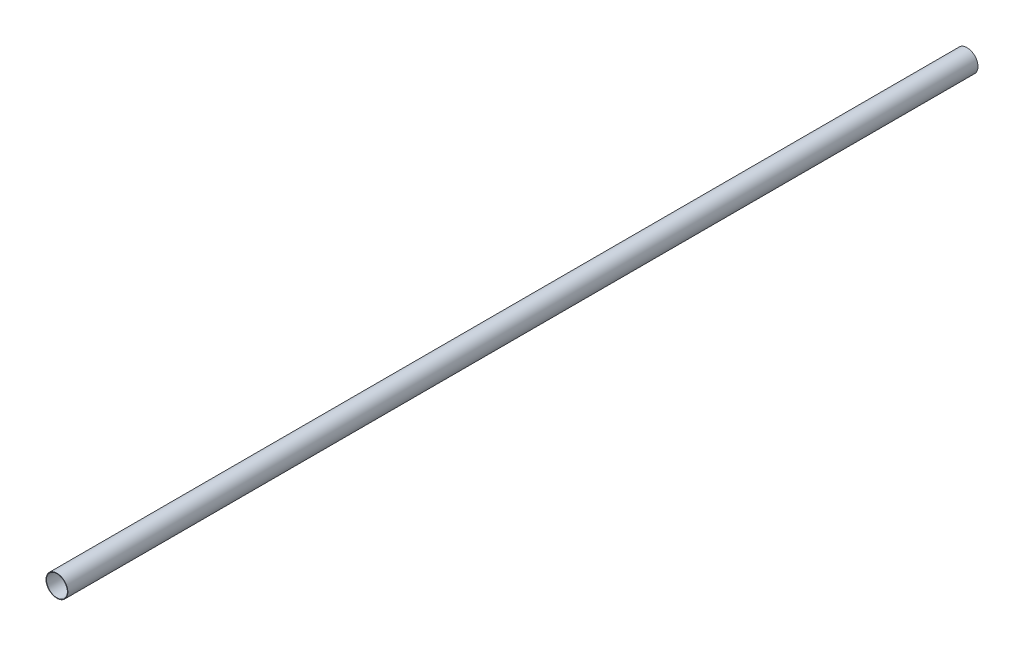
from build123d import *

# Parameters (mm, degrees)
SKETCH1_R           = 15
SKETCH1_R_2         = 14.35
BOSS_EXTRUDE1_DEPTH = 1250


with BuildPart() as part:
    # Sketch1 → Boss-Extrude1 (new body)
    with BuildSketch(Plane.XY):
        Circle(SKETCH1_R)
        Circle(SKETCH1_R_2, mode=Mode.SUBTRACT)
    extrude(amount=BOSS_EXTRUDE1_DEPTH)


solid = part.part
